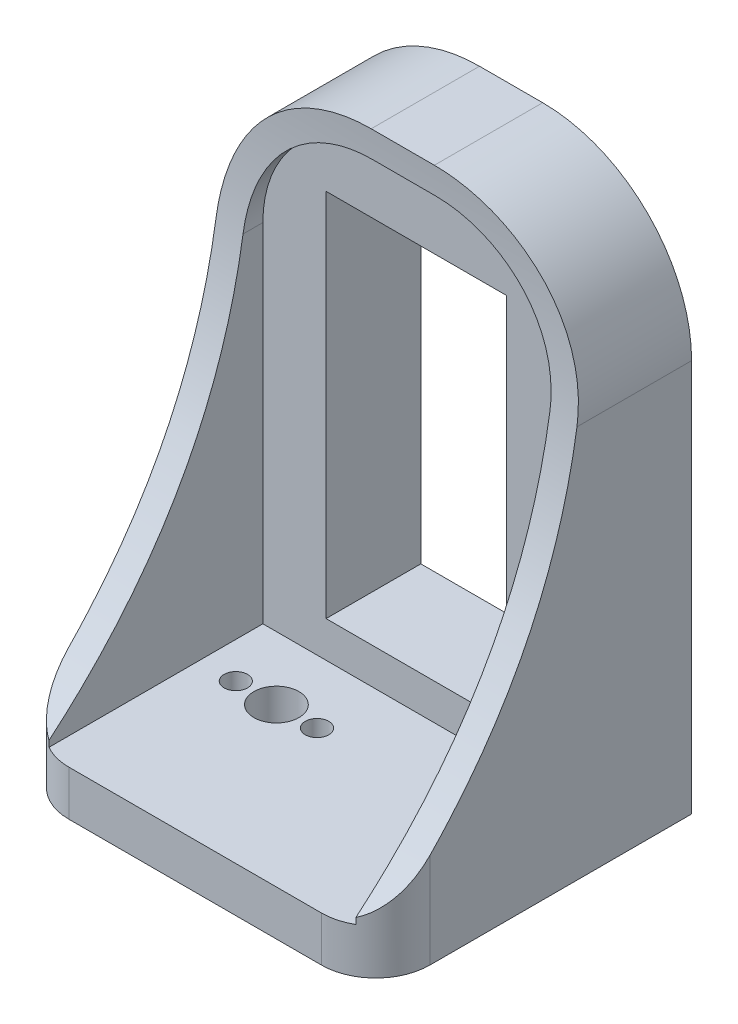
from build123d import *

# Parameters (mm, degrees)
SKETCH1_W           = 40
SKETCH1_H           = 35
BOSS_EXTRUDE1_DEPTH = 60
SKETCH2_W           = 24.5
SKETCH2_H           = 55
CUT_EXTRUDE1_DEPTH  = 46
BOSS_EXTRUDE2_DEPTH = 3
BOSS_EXTRUDE3_DEPTH = 34
FILLET1_START       = -8
FILLET1_DEPTH       = 3.199770331
FILLET1_START_2     = -17
FILLET1_2_DEPTH     = 34
FILLET2_R           = 16.5
FILLET3_R           = 6
SKETCH5_W           = 20
SKETCH5_H           = 41
CUT_EXTRUDE2_DEPTH  = 68.825143224
SKETCH8_R           = 1.3
SKETCH8_R_2         = 2.5
CUT_EXTRUDE5_DEPTH  = 62.083959026
SKETCH9_R           = 2.15
CUT_EXTRUDE6_DEPTH  = 10


with BuildPart() as part:
    # Sketch1 → Boss-Extrude1 (new body)
    with BuildSketch(Plane(origin=(0, 0, 0), x_dir=(1, 0, 0), z_dir=(0, 1, 0))):
        Rectangle(SKETCH1_W, SKETCH1_H)
    extrude(amount=BOSS_EXTRUDE1_DEPTH)

    # Sketch2 → Cut-Extrude1 (cut)
    with BuildSketch(Plane(origin=(20, 0, 0), x_dir=(0, 0, -1), z_dir=(1, 0, 0))):
        with Locations((-5.25, 32.5)):
            Rectangle(SKETCH2_W, SKETCH2_H)
    extrude(amount=-CUT_EXTRUDE1_DEPTH, mode=Mode.SUBTRACT)

    # Sketch3 → Boss-Extrude2 (add)
    with BuildSketch(Plane(origin=(20, 0, 0), x_dir=(0, 0, -1), z_dir=(1, 0, 0))):
        with BuildLine():
            Line((7, 60), (5.5, 60))
            add(Edge.make_bspline(
                [(5.5, 60), (7.518062239, 25.49671142), (-17.5, 5)],
                knots=[0, 0, 0, 1, 1, 1], degree=2))
            Line((-17.5, 5), (7, 5))
            Line((7, 5), (7, 60))
        make_face()
    boss_extrude2 = extrude(amount=-BOSS_EXTRUDE2_DEPTH)

    # Mirror1: Boss-Extrude2 across plane
    add(boss_extrude2.mirror(Plane(origin=(0, 0, 0), x_dir=(0, 0, 1), z_dir=(1, 0, 0))))

    # Sketch4 → Boss-Extrude3 (add)
    with BuildSketch(Plane.ZY.offset(-17)):
        with BuildLine():
            Line((-7, 60), (-7, 57))
            Line((-7, 57), (-5.625022797, 57))
            add(Edge.make_bspline(
                [(-5.625022797, 57), (-5.588521617, 58.486524947), (-5.499999996, 60.000000071)],
                knots=[0.956135337, 0.956135337, 0.956135337, 1, 1, 1], degree=2))
            Line((-5.499999996, 60.000000071), (-7, 60))
        make_face()
    extrude(amount=BOSS_EXTRUDE3_DEPTH)

    # Fillet1: read off the stored shape, not the designer's step
    # Fillet1 outline → Fillet1 (add)
    with BuildSketch(Plane.XY.offset(FILLET1_START)):
        with BuildLine():
            Line((-17, 57), (-17, 43.5))
            ThreePointArc((-17, 43.5), (-13.045941546, 53.045941546), (-3.5, 57))
            Line((-3.5, 57), (-17, 57))
        make_face()
        with BuildLine():
            Line((17, 57), (3.5, 57))
            ThreePointArc((3.5, 57), (13.045941546, 53.045941546), (17, 43.5))
            Line((17, 43.5), (17, 57))
        make_face()
    extrude(amount=FILLET1_DEPTH)

    # Fillet1 2 outline → Fillet1 2 (cut)
    with BuildSketch(Plane.YZ.offset(FILLET1_START_2)):
        with BuildLine():
            add(Edge.make_bspline(
                [(57, -5.625022797), (49.946623945, -5.798216358), (43.499999985, -4.800229766)],
                knots=[0.043864662, 0.043864662, 0.043864662, 0.251997034, 0.251997034, 0.251997034], degree=2))
            Line((57, -5.625022797), (57, -4.800229669))
            Line((57, -4.800229669), (43.499999985, -4.800229766))
        make_face()
    extrude(amount=FILLET1_2_DEPTH, mode=Mode.SUBTRACT)

    # Fillet2
    # the kernel refuses this fillet: 16.5 mm, written as the material it takes off along each edge
    with BuildSketch(Plane(origin=(20, 60, -58.75), x_dir=(0, -1, 0), z_dir=(0, 0, 1)), Plane(origin=(-20, 60, 35.75), x_dir=(0, -1, 0), z_dir=(0, 0, -1))) as fillet2_piece_1:
        with BuildLine():
            CenterArc((FILLET2_R, -FILLET2_R), FILLET2_R, 90, 90)
            Line((0, -FILLET2_R), (0, 0))
            Line((0, 0), (FILLET2_R, 0))
        make_face()
    extrude(amount=94.5, mode=Mode.SUBTRACT)

    # Fillet3
    # the kernel refuses this fillet: 6 mm, written as the material it takes off along each edge
    with BuildSketch(Plane(origin=(-20, -15, 17.5), x_dir=(0, 0, -1), z_dir=(0, 1, 0))) as fillet3_piece_1:
        with BuildLine():
            CenterArc((FILLET3_R, -FILLET3_R), FILLET3_R, 90, 90)
            Line((0, -FILLET3_R), (0, 0))
            Line((0, 0), (FILLET3_R, 0))
        make_face()
    extrude(amount=35, mode=Mode.SUBTRACT)
    with BuildSketch(Plane(origin=(20, -15, 17.5), x_dir=(0, 0, -1), z_dir=(0, 1, 0))) as fillet3_piece_2:
        with BuildLine():
            CenterArc((FILLET3_R, FILLET3_R), FILLET3_R, 180, 90)
            Line((0, FILLET3_R), (0, 0))
            Line((0, 0), (FILLET3_R, 0))
        make_face()
    extrude(amount=35, mode=Mode.SUBTRACT)

    # Sketch5 → Cut-Extrude2 (cut, through all)
    with BuildSketch(Plane.XY.offset(-7)):
        with Locations((0, 29.5)):
            Rectangle(SKETCH5_W, SKETCH5_H)
    extrude(amount=-CUT_EXTRUDE2_DEPTH, mode=Mode.SUBTRACT)

    # Sketch8 → Cut-Extrude5 (cut, through all)
    with BuildSketch(Plane(origin=(0, 5, 0), x_dir=(1, 0, 0), z_dir=(0, 1, 0))):
        with Locations(Location((-4, 0, 0), (0, 0, 270))):
            Circle(SKETCH8_R)
        with Locations(Location((-8.5, 0, 0), (0, 0, 270))):
            Circle(SKETCH8_R_2)
        with Locations(Location((-13, 0, 0), (0, 0, 270))):
            Circle(SKETCH8_R)
    extrude(amount=-CUT_EXTRUDE5_DEPTH, mode=Mode.SUBTRACT)

    # Sketch9 → Cut-Extrude6 (cut)
    with BuildSketch(Plane(origin=(0, 0, -17.5), x_dir=(-1, 0, 0), z_dir=(0, 0, -1))):
        with Locations((-5, 54.45)):
            Circle(SKETCH9_R)
        with Locations((5, 54.45)):
            Circle(SKETCH9_R)
        with Locations((5, 4.55)):
            Circle(SKETCH9_R)
        with Locations((-5, 4.55)):
            Circle(SKETCH9_R)
    extrude(amount=-CUT_EXTRUDE6_DEPTH, mode=Mode.SUBTRACT)


solid = part.part
